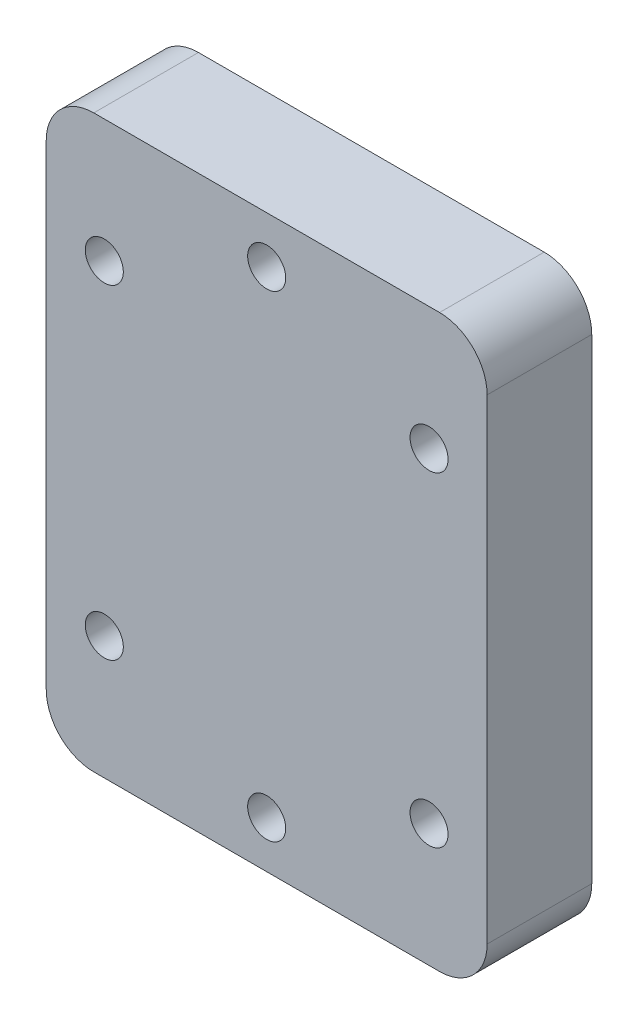
from build123d import *

# Parameters (mm, degrees)
BOSS_EXTRUDE1_DEPTH      = 2
BOSS_EXTRUDE1_DEPTH_BACK = 9
SKETCH1_W                = 46.35
SKETCH1_H                = 60
SKETCH1_R                = 2
SKETCH2_W                = 30
SKETCH2_H                = 30
CUT_EXTRUDE1_DEPTH       = 6.35
SKETCH4_R                = 2
BOSS_EXTRUDE4_DEPTH      = 0.85
FILLET1_R                = 5


with BuildPart() as part:
    # Sketch1 → Boss-Extrude1 (new, two sides: drawn at the far end of the back side and taken through both)
    with BuildSketch(Plane.XY.offset(-BOSS_EXTRUDE1_DEPTH_BACK)):
        Rectangle(SKETCH1_W, SKETCH1_H)
        with Locations((-17.071067812, -17.071067812)):
            Circle(SKETCH1_R, mode=Mode.SUBTRACT)
        with Locations((0, -25.060622825)):
            Circle(SKETCH1_R, mode=Mode.SUBTRACT)
        with Locations((17.071067812, -17.071067812)):
            Circle(SKETCH1_R, mode=Mode.SUBTRACT)
        with Locations((-17.071067812, 17.071067812)):
            Circle(SKETCH1_R, mode=Mode.SUBTRACT)
        with Locations((0, 25.060622825)):
            Circle(SKETCH1_R, mode=Mode.SUBTRACT)
        with Locations((17.071067812, 17.071067812)):
            Circle(SKETCH1_R, mode=Mode.SUBTRACT)
    extrude(amount=BOSS_EXTRUDE1_DEPTH + BOSS_EXTRUDE1_DEPTH_BACK)

    # Sketch2 → Cut-Extrude1 (cut)
    with BuildSketch(Plane(origin=(0, 0, -9), x_dir=(-1, 0, 0), z_dir=(0, 0, -1))):
        Rectangle(SKETCH2_W, SKETCH2_H)
    extrude(amount=-CUT_EXTRUDE1_DEPTH, mode=Mode.SUBTRACT)

    # Sketch4 → Boss-Extrude4 (add)
    with BuildSketch(Plane(origin=(0, 0, -9), x_dir=(-1, 0, 0), z_dir=(0, 0, -1))):
        with Locations((-17.071067812, 17.071067812)):
            Circle(SKETCH4_R)
        with Locations((17.071067812, 17.071067812)):
            Circle(SKETCH4_R)
        with Locations((-17.071067812, -17.071067812)):
            Circle(SKETCH4_R)
        with Locations((17.071067812, -17.071067812)):
            Circle(SKETCH4_R)
    extrude(amount=-BOSS_EXTRUDE4_DEPTH)

    # Fillet1
    fillet1_edges = [part.edges().sort_by_distance(p)[0] for p in [
        (23.175, 30, -3.5),
        (-23.175, 30, -3.5),
        (-23.175, -30, -3.5),
        (23.175, -30, -3.5),
    ]]
    fillet(fillet1_edges, radius=FILLET1_R)


solid = part.part
